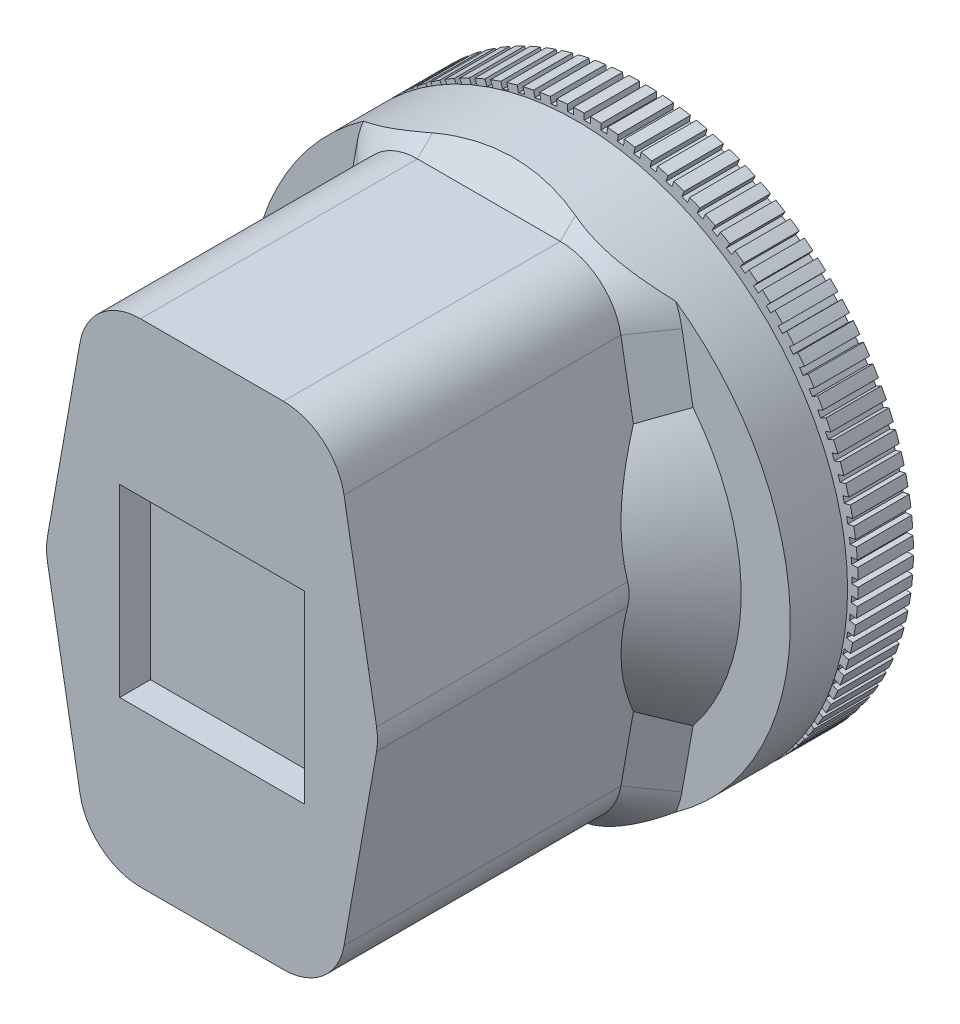
from build123d import *

# Parameters (mm, degrees)
SKETCH1_W                = 60
SKETCH1_H                = 80
BOSS_EXTRUDE1_DEPTH      = 30
SKETCH2_W                = 30
SKETCH2_H                = 30
CUT_EXTRUDE1_DEPTH       = 5
CHAMFER1_SIZE            = 56.712818196
CHAMFER1_SIZE_2          = 10
BOSS_EXTRUDE2_DEPTH      = 10
BOSS_EXTRUDE2_DEPTH_BACK = 20
SKETCH3_R                = 40
FILLET1_R                = 10
FILLET2_R                = 10
CHAMFER2_START           = -24.0000001
CHAMFER2_DEPTH           = 14.0000001
CHAMFER2_START_2         = -24.0000007
CHAMFER2_3_DEPTH         = 14.0000007
SKETCH4_R                = 44
BOSS_EXTRUDE3_DEPTH      = 20
CHAMFER3_SIZE            = 5
SKETCH5_W                = 7.255778377
SKETCH5_H                = 1.701163536
SKETCH6_W                = 1
SKETCH6_H                = 2
CUT_EXTRUDE2_DEPTH       = 10
CIRPATTERN1_COUNT        = 100
SKETCH7_R                = 37.5
SKETCH7_R_2              = 27.5
CUT_EXTRUDE3_DEPTH       = 10
SKETCH8_W                = 30
SKETCH8_H                = 30
CUT_EXTRUDE4_DEPTH       = 10


with BuildPart() as part:
    # Sketch1 → Boss-Extrude1 (new, symmetric)
    with BuildSketch(Plane.XY):
        with Locations((-156.698196892, 56.325115443)):
            Rectangle(SKETCH1_W, SKETCH1_H)
    extrude(amount=BOSS_EXTRUDE1_DEPTH, both=True)

    # Sketch2 → Cut-Extrude1 (cut, symmetric)
    with BuildSketch(Plane.XY.offset(30)):
        with Locations((-156.698196892, 56.325115443)):
            Rectangle(SKETCH2_W, SKETCH2_H)
    extrude(amount=CUT_EXTRUDE1_DEPTH, both=True, mode=Mode.SUBTRACT)

    # Chamfer1
    # the kernel refuses this chamfer: 56.712818196, 10 mm, written as the material it takes off along each edge
    with BuildSketch(Plane(origin=(-126.698196892, 16.325115443, 177.370458337), x_dir=(0, 1, 0), z_dir=(0, 0, -1)), Plane(origin=(-186.698196892, 16.325115443, -177.370458337), x_dir=(0, 1, 0), z_dir=(0, 0, 1))) as chamfer1_piece_1:
        Polygon((CHAMFER1_SIZE, 0), (0, -CHAMFER1_SIZE_2), (0, 0), align=None)
    extrude(amount=354.740916674, mode=Mode.SUBTRACT)
    with BuildSketch(Plane(origin=(-126.698196892, 96.325115443, 177.370458337), x_dir=(-1, 0, 0), z_dir=(0, 0, -1)), Plane(origin=(-186.698196892, 96.325115443, -177.370458337), x_dir=(1, 0, 0), z_dir=(0, 0, 1))) as chamfer1_piece_2:
        Polygon((CHAMFER1_SIZE_2, 0), (0, -CHAMFER1_SIZE), (0, 0), align=None)
    extrude(amount=354.740916674, mode=Mode.SUBTRACT)

    # Sketch3 → Boss-Extrude2 (add, two sides: drawn at the far end of the back side and taken through both)
    with BuildSketch(Plane(origin=(0, 0, -30), x_dir=(-1, 0, 0), z_dir=(0, 0, -1)).offset(-BOSS_EXTRUDE2_DEPTH_BACK)):
        with Locations((156.698196892, 56.325115443)):
            Circle(SKETCH3_R)
    extrude(amount=BOSS_EXTRUDE2_DEPTH + BOSS_EXTRUDE2_DEPTH_BACK)

    # Fillet1
    # the kernel refuses this fillet: 10 mm, written as the material it takes off along each edge
    with BuildSketch(Plane(origin=(-136.698196892, 16.325115443, 50.977490779), x_dir=(-1, 0, 0), z_dir=(0, 0, -1))) as fillet1_piece_1_section:
        with BuildLine():
            CenterArc((FILLET1_R * 0.839099631177, FILLET1_R), FILLET1_R, 190, 80)
            Line((-FILLET1_R * 0.145708121835, FILLET1_R * 0.826351822333), (0, 0))
            Line((0, 0), (FILLET1_R * 0.839099631177, 0))
        make_face()
    fillet1_piece_1 = extrude(amount=101.954981559, mode=Mode.PRIVATE)
    fillet1_piece_1 = fillet1_piece_1 - Plane(origin=(-156.698196892, 56.325115443, 50.977490779), x_dir=(-1, 0, 0), z_dir=(0, 0, -1)) * Cylinder(40, 238, mode=Mode.PRIVATE)
    fillet1_piece_1 = split(fillet1_piece_1, bisect_by=Plane(origin=(-136.698196892, 16.325115443, -10), z_dir=(0, 0, 1)), keep=Keep.TOP, mode=Mode.PRIVATE)
    add(fillet1_piece_1, mode=Mode.SUBTRACT)
    with BuildSketch(Plane(origin=(-136.698196892, 16.325115443, 50.977490779), x_dir=(-1, 0, 0), z_dir=(0, 0, -1))) as fillet1_piece_2_section:
        with BuildLine():
            CenterArc((FILLET1_R * 0.839099631177, FILLET1_R), FILLET1_R, 190, 80)
            Line((-FILLET1_R * 0.145708121835, FILLET1_R * 0.826351822333), (0, 0))
            Line((0, 0), (FILLET1_R * 0.839099631177, 0))
        make_face()
    fillet1_piece_2 = extrude(amount=101.954981559, mode=Mode.PRIVATE)
    fillet1_piece_2 = fillet1_piece_2 & Plane(origin=(-156.698196892, 56.325115443, 50.977490779), x_dir=(-1, 0, 0), z_dir=(0, 0, -1)) * Cylinder(40, 238, mode=Mode.PRIVATE)
    fillet1_piece_2 = split(fillet1_piece_2, bisect_by=Plane(origin=(-136.698196892, 16.325115443, -10), z_dir=(0, 0, 1)), keep=Keep.TOP, mode=Mode.PRIVATE)
    add(fillet1_piece_2, mode=Mode.SUBTRACT)
    with BuildSketch(Plane(origin=(-136.698196892, 16.325115443, 50.977490779), x_dir=(-1, 0, 0), z_dir=(0, 0, -1))) as fillet1_piece_3_section:
        with BuildLine():
            CenterArc((FILLET1_R * 0.839099631177, FILLET1_R), FILLET1_R, 190, 80)
            Line((-FILLET1_R * 0.145708121835, FILLET1_R * 0.826351822333), (0, 0))
            Line((0, 0), (FILLET1_R * 0.839099631177, 0))
        make_face()
    fillet1_piece_3 = extrude(amount=101.954981559, mode=Mode.PRIVATE)
    fillet1_piece_3 = fillet1_piece_3 - Plane(origin=(-156.698196892, 56.325115443, 50.977490779), x_dir=(-1, 0, 0), z_dir=(0, 0, -1)) * Cylinder(40, 238, mode=Mode.PRIVATE)
    fillet1_piece_3 = split(fillet1_piece_3, bisect_by=Plane(origin=(-136.698196892, 16.325115443, -10), z_dir=(0, 0, -1)), keep=Keep.TOP, mode=Mode.PRIVATE)
    add(fillet1_piece_3, mode=Mode.SUBTRACT)
    with BuildSketch(Plane(origin=(-176.698196892, 16.325115443, -50.977490779), x_dir=(-0.17364817766745544, 0.9848077530121156, 0), z_dir=(0, 0, 1))) as fillet1_piece_4_section:
        with BuildLine():
            CenterArc((FILLET1_R * 0.839099631177, -FILLET1_R), FILLET1_R, 90, 80)
            Line((-FILLET1_R * 0.145708121835, -FILLET1_R * 0.826351822333), (0, 0))
            Line((0, 0), (FILLET1_R * 0.839099631177, 0))
        make_face()
    fillet1_piece_4 = extrude(amount=101.954981559, mode=Mode.PRIVATE)
    fillet1_piece_4 = split(fillet1_piece_4, bisect_by=Plane(origin=(-176.698196892, 16.325115443, -10), z_dir=(0, 0, -1)), keep=Keep.TOP, mode=Mode.PRIVATE)
    fillet1_piece_4 = fillet1_piece_4 - Plane(origin=(-156.698196892, 56.325115443, -50.977490779), x_dir=(-1, 0, 0), z_dir=(0, 0, -1)) * Cylinder(40, 238, mode=Mode.PRIVATE)
    add(fillet1_piece_4, mode=Mode.SUBTRACT)
    with BuildSketch(Plane(origin=(-176.698196892, 16.325115443, -50.977490779), x_dir=(-0.17364817766745544, 0.9848077530121156, 0), z_dir=(0, 0, 1))) as fillet1_piece_5_section:
        with BuildLine():
            CenterArc((FILLET1_R * 0.839099631177, -FILLET1_R), FILLET1_R, 90, 80)
            Line((-FILLET1_R * 0.145708121835, -FILLET1_R * 0.826351822333), (0, 0))
            Line((0, 0), (FILLET1_R * 0.839099631177, 0))
        make_face()
    fillet1_piece_5 = extrude(amount=101.954981559, mode=Mode.PRIVATE)
    fillet1_piece_5 = split(fillet1_piece_5, bisect_by=Plane(origin=(-176.698196892, 16.325115443, -10), z_dir=(0, 0, 1)), keep=Keep.TOP, mode=Mode.PRIVATE)
    fillet1_piece_5 = fillet1_piece_5 & Plane(origin=(-156.698196892, 56.325115443, -50.977490779), x_dir=(-1, 0, 0), z_dir=(0, 0, -1)) * Cylinder(40, 238, mode=Mode.PRIVATE)
    add(fillet1_piece_5, mode=Mode.SUBTRACT)
    with BuildSketch(Plane(origin=(-176.698196892, 16.325115443, -50.977490779), x_dir=(-0.17364817766745544, 0.9848077530121156, 0), z_dir=(0, 0, 1))) as fillet1_piece_6_section:
        with BuildLine():
            CenterArc((FILLET1_R * 0.839099631177, -FILLET1_R), FILLET1_R, 90, 80)
            Line((-FILLET1_R * 0.145708121835, -FILLET1_R * 0.826351822333), (0, 0))
            Line((0, 0), (FILLET1_R * 0.839099631177, 0))
        make_face()
    fillet1_piece_6 = extrude(amount=101.954981559, mode=Mode.PRIVATE)
    fillet1_piece_6 = split(fillet1_piece_6, bisect_by=Plane(origin=(-176.698196892, 16.325115443, -10), z_dir=(0, 0, 1)), keep=Keep.TOP, mode=Mode.PRIVATE)
    fillet1_piece_6 = fillet1_piece_6 - Plane(origin=(-156.698196892, 56.325115443, -50.977490779), x_dir=(-1, 0, 0), z_dir=(0, 0, -1)) * Cylinder(40, 238, mode=Mode.PRIVATE)
    add(fillet1_piece_6, mode=Mode.SUBTRACT)
    with BuildSketch(Plane(origin=(-136.698196892, 96.325115443, 50.977490779), x_dir=(-1, 0, 0), z_dir=(0, 0, -1))) as fillet1_piece_7_section:
        with BuildLine():
            CenterArc((FILLET1_R * 0.839099631177, -FILLET1_R), FILLET1_R, 90, 80)
            Line((-FILLET1_R * 0.145708121835, -FILLET1_R * 0.826351822333), (0, 0))
            Line((0, 0), (FILLET1_R * 0.839099631177, 0))
        make_face()
    fillet1_piece_7 = extrude(amount=101.954981559, mode=Mode.PRIVATE)
    fillet1_piece_7 = split(fillet1_piece_7, bisect_by=Plane(origin=(-136.698196892, 96.325115443, -10), z_dir=(0, 0, 1)), keep=Keep.TOP, mode=Mode.PRIVATE)
    fillet1_piece_7 = fillet1_piece_7 - Plane(origin=(-156.698196892, 56.325115443, 50.977490779), x_dir=(-1, 0, 0), z_dir=(0, 0, -1)) * Cylinder(40, 238, mode=Mode.PRIVATE)
    add(fillet1_piece_7, mode=Mode.SUBTRACT)
    with BuildSketch(Plane(origin=(-136.698196892, 96.325115443, 50.977490779), x_dir=(-1, 0, 0), z_dir=(0, 0, -1))) as fillet1_piece_8_section:
        with BuildLine():
            CenterArc((FILLET1_R * 0.839099631177, -FILLET1_R), FILLET1_R, 90, 80)
            Line((-FILLET1_R * 0.145708121835, -FILLET1_R * 0.826351822333), (0, 0))
            Line((0, 0), (FILLET1_R * 0.839099631177, 0))
        make_face()
    fillet1_piece_8 = extrude(amount=101.954981559, mode=Mode.PRIVATE)
    fillet1_piece_8 = split(fillet1_piece_8, bisect_by=Plane(origin=(-136.698196892, 96.325115443, -10), z_dir=(0, 0, 1)), keep=Keep.TOP, mode=Mode.PRIVATE)
    fillet1_piece_8 = fillet1_piece_8 & Plane(origin=(-156.698196892, 56.325115443, 50.977490779), x_dir=(-1, 0, 0), z_dir=(0, 0, -1)) * Cylinder(40, 238, mode=Mode.PRIVATE)
    add(fillet1_piece_8, mode=Mode.SUBTRACT)
    with BuildSketch(Plane(origin=(-136.698196892, 96.325115443, 50.977490779), x_dir=(-1, 0, 0), z_dir=(0, 0, -1))) as fillet1_piece_9_section:
        with BuildLine():
            CenterArc((FILLET1_R * 0.839099631177, -FILLET1_R), FILLET1_R, 90, 80)
            Line((-FILLET1_R * 0.145708121835, -FILLET1_R * 0.826351822333), (0, 0))
            Line((0, 0), (FILLET1_R * 0.839099631177, 0))
        make_face()
    fillet1_piece_9 = extrude(amount=101.954981559, mode=Mode.PRIVATE)
    fillet1_piece_9 = split(fillet1_piece_9, bisect_by=Plane(origin=(-136.698196892, 96.325115443, -10), z_dir=(0, 0, -1)), keep=Keep.TOP, mode=Mode.PRIVATE)
    fillet1_piece_9 = fillet1_piece_9 - Plane(origin=(-156.698196892, 56.325115443, 50.977490779), x_dir=(-1, 0, 0), z_dir=(0, 0, -1)) * Cylinder(40, 238, mode=Mode.PRIVATE)
    add(fillet1_piece_9, mode=Mode.SUBTRACT)
    with BuildSketch(Plane(origin=(-176.698196892, 96.325115443, -50.977490779), x_dir=(1, 0, 0), z_dir=(0, 0, 1))) as fillet1_piece_10_section:
        with BuildLine():
            CenterArc((FILLET1_R * 0.839099631177, -FILLET1_R), FILLET1_R, 90, 80)
            Line((-FILLET1_R * 0.145708121835, -FILLET1_R * 0.826351822333), (0, 0))
            Line((0, 0), (FILLET1_R * 0.839099631177, 0))
        make_face()
    fillet1_piece_10 = extrude(amount=101.954981559, mode=Mode.PRIVATE)
    fillet1_piece_10 = fillet1_piece_10 - Plane(origin=(-156.698196892, 56.325115443, -50.977490779), x_dir=(-1, 0, 0), z_dir=(0, 0, -1)) * Cylinder(40, 238, mode=Mode.PRIVATE)
    fillet1_piece_10 = split(fillet1_piece_10, bisect_by=Plane(origin=(-176.698196892, 96.325115443, -10), z_dir=(0, 0, -1)), keep=Keep.TOP, mode=Mode.PRIVATE)
    add(fillet1_piece_10, mode=Mode.SUBTRACT)
    with BuildSketch(Plane(origin=(-176.698196892, 96.325115443, -50.977490779), x_dir=(1, 0, 0), z_dir=(0, 0, 1))) as fillet1_piece_11_section:
        with BuildLine():
            CenterArc((FILLET1_R * 0.839099631177, -FILLET1_R), FILLET1_R, 90, 80)
            Line((-FILLET1_R * 0.145708121835, -FILLET1_R * 0.826351822333), (0, 0))
            Line((0, 0), (FILLET1_R * 0.839099631177, 0))
        make_face()
    fillet1_piece_11 = extrude(amount=101.954981559, mode=Mode.PRIVATE)
    fillet1_piece_11 = fillet1_piece_11 - Plane(origin=(-156.698196892, 56.325115443, -50.977490779), x_dir=(-1, 0, 0), z_dir=(0, 0, -1)) * Cylinder(40, 238, mode=Mode.PRIVATE)
    fillet1_piece_11 = split(fillet1_piece_11, bisect_by=Plane(origin=(-176.698196892, 96.325115443, -10), z_dir=(0, 0, 1)), keep=Keep.TOP, mode=Mode.PRIVATE)
    add(fillet1_piece_11, mode=Mode.SUBTRACT)
    with BuildSketch(Plane(origin=(-176.698196892, 96.325115443, -50.977490779), x_dir=(1, 0, 0), z_dir=(0, 0, 1))) as fillet1_piece_12_section:
        with BuildLine():
            CenterArc((FILLET1_R * 0.839099631177, -FILLET1_R), FILLET1_R, 90, 80)
            Line((-FILLET1_R * 0.145708121835, -FILLET1_R * 0.826351822333), (0, 0))
            Line((0, 0), (FILLET1_R * 0.839099631177, 0))
        make_face()
    fillet1_piece_12 = extrude(amount=101.954981559, mode=Mode.PRIVATE)
    fillet1_piece_12 = fillet1_piece_12 & Plane(origin=(-156.698196892, 56.325115443, -50.977490779), x_dir=(-1, 0, 0), z_dir=(0, 0, -1)) * Cylinder(40, 238, mode=Mode.PRIVATE)
    fillet1_piece_12 = split(fillet1_piece_12, bisect_by=Plane(origin=(-176.698196892, 96.325115443, -10), z_dir=(0, 0, 1)), keep=Keep.TOP, mode=Mode.PRIVATE)
    add(fillet1_piece_12, mode=Mode.SUBTRACT)

    # Fillet2
    fillet2_edges = [part.edges().sort_by_distance(p)[0] for p in [
        (-183.75127612, 56.325115443, 10),
        (-129.645117664, 56.325115443, 10),
    ]]
    fillet(fillet2_edges, radius=FILLET2_R)

    # Chamfer2: read off the stored shape, not the designer's step
    # Chamfer2 outline → Chamfer2 (cut)
    with BuildSketch(Plane.XY.offset(CHAMFER2_START)):
        with BuildLine():
            ThreePointArc((-136.037863961, 22.073828706), (-116.698196892, 56.325115443), (-136.03786396, 90.57640218))
            ThreePointArc((-136.03786396, 90.57640218), (-156.698196892, 96.325115443), (-177.358529824, 90.57640218))
            ThreePointArc((-177.358529824, 90.57640218), (-196.698196892, 56.325115443), (-177.358529823, 22.073828706))
            ThreePointArc((-177.358529823, 22.073828706), (-156.698196892, 16.325115443), (-136.037863961, 22.073828706))
        make_face()
    extrude(amount=CHAMFER2_DEPTH, mode=Mode.SUBTRACT)

    # Chamfer2 2 outline → Chamfer2 2 (revolve)
    with BuildSketch(Plane(origin=(-156.698196892, 56.325115443, 0), x_dir=(1, 0, 0), z_dir=(0, -1, 0))):
        Polygon((40, -24), (26.641334205, -10.641334205), (0, -10.641334205), (0, -24), align=None)
    revolve(axis=Axis((-156.698196892, 56.325115443, 0), (0, 0, 1)))

    # Chamfer2 3 outline → Chamfer2 3 (add)
    with BuildSketch(Plane.XY.offset(CHAMFER2_START_2)):
        with BuildLine():
            Line((-129.951306252, 58.06159722), (-135.241115674, 88.06159722))
            ThreePointArc((-135.241115674, 88.06159722), (-135.556200227, 89.345387766), (-136.03786396, 90.57640218))
            ThreePointArc((-136.03786396, 90.57640218), (-145.975591553, 94.861147085), (-156.698196892, 96.325115443))
            ThreePointArc((-156.698196892, 96.325115443), (-167.420802231, 94.861147085), (-177.358529824, 90.57640218))
            ThreePointArc((-177.358529824, 90.57640218), (-177.840193557, 89.345387766), (-178.15527811, 88.06159722))
            Line((-178.15527811, 88.06159722), (-183.445087531, 58.06159722))
            ThreePointArc((-183.445087531, 58.06159722), (-183.597010001, 56.325115444), (-183.445087531, 54.588633667))
            Line((-183.445087531, 54.588633667), (-178.15527811, 24.588633667))
            ThreePointArc((-178.15527811, 24.588633667), (-177.840193557, 23.304843121), (-177.358529824, 22.073828706))
            ThreePointArc((-177.358529824, 22.073828706), (-167.420802231, 17.789083801), (-156.698196892, 16.325115443))
            ThreePointArc((-156.698196892, 16.325115443), (-145.975591553, 17.789083801), (-136.037863961, 22.073828706))
            ThreePointArc((-136.037863961, 22.073828706), (-135.556200227, 23.304843121), (-135.241115674, 24.588633667))
            Line((-135.241115674, 24.588633667), (-129.951306252, 54.588633667))
            ThreePointArc((-129.951306252, 54.588633667), (-129.799383782, 56.325115444), (-129.951306252, 58.06159722))
        make_face()
    extrude(amount=CHAMFER2_3_DEPTH)

    # Sketch4 → Boss-Extrude3 (add)
    with BuildSketch(Plane(origin=(0, 0, -40), x_dir=(-1, 0, 0), z_dir=(0, 0, -1))):
        with Locations((156.698196892, 56.325115443)):
            Circle(SKETCH4_R)
    extrude(amount=-BOSS_EXTRUDE3_DEPTH)

    # Chamfer3
    # the kernel refuses this chamfer: 5 mm, written as the material it adds along each edge
    with BuildSketch(Plane(origin=(-132.432320123, 40.518104806, -20), x_dir=(0, 0, 1), z_dir=(-0.17364817769068303, -0.9848077530080199, 0)), Plane(origin=(-178.15527811, 24.588633667, -20), x_dir=(0, 0, 1), z_dir=(-0.17364817765884538, 0.9848077530136338, 0))) as chamfer3_piece_1:
        Polygon((CHAMFER3_SIZE, 0), (0, -CHAMFER3_SIZE), (0, 0), align=None)
    extrude(amount=16.175208908)
    with BuildSketch(Plane(origin=(-145.089193204, 26.325115443, -20), x_dir=(0, -1, 0), z_dir=(-1, 0, 0))) as chamfer3_piece_2_section:
        Polygon((10, CHAMFER3_SIZE), (10 + CHAMFER3_SIZE, 0), (10, 0), align=None)
    chamfer3_piece_2 = revolve(axis=Axis((-145.089193204, 26.325115443, -20), (0, 0, 1)), revolution_arc=64.841191691, mode=Mode.PRIVATE)
    chamfer3_piece_2 = chamfer3_piece_2 & Plane(origin=(-156.698196892, 56.325115443, -20), x_dir=(-1, 0, 0), z_dir=(0, 0, -1)) * Cylinder(44, 61, mode=Mode.PRIVATE)
    add(chamfer3_piece_2)
    with BuildSketch(Plane(origin=(-168.30720058, 26.325115443, -20), x_dir=(0, -1, 0), z_dir=(1, 0, 0))) as chamfer3_piece_3_section:
        Polygon((10, -CHAMFER3_SIZE), (10 + CHAMFER3_SIZE, 0), (10, 0), align=None)
    chamfer3_piece_3 = revolve(axis=Axis((-168.30720058, 26.325115443, -20), (0, 0, -1)), revolution_arc=64.841191691, mode=Mode.PRIVATE)
    chamfer3_piece_3 = chamfer3_piece_3 & Plane(origin=(-156.698196892, 56.325115443, -20), x_dir=(-1, 0, 0), z_dir=(0, 0, -1)) * Cylinder(44, 60, mode=Mode.PRIVATE)
    add(chamfer3_piece_3)
    with BuildSketch(Plane(origin=(-156.698196892, 16.325115443, -20), x_dir=(0, 0, 1), z_dir=(-1, 0, 0))) as chamfer3_piece_4_section:
        Polygon((CHAMFER3_SIZE, 0), (0, -CHAMFER3_SIZE), (0, 0), align=None)
    chamfer3_piece_4 = extrude(amount=11.609003688, mode=Mode.PRIVATE)
    chamfer3_piece_4 = chamfer3_piece_4 & Plane(origin=(-156.698196892, 56.325115443, -20), x_dir=(-1, 0, 0), z_dir=(0, 0, -1)) * Cylinder(44, 44, mode=Mode.PRIVATE)
    add(chamfer3_piece_4)
    with BuildSketch(Plane(origin=(-180.96407366, 72.13212608, -20), x_dir=(0, 0, 1), z_dir=(0.17364817765884544, 0.9848077530136338, 0)), Plane(origin=(-135.241115674, 88.06159722, -20), x_dir=(0, 0, 1), z_dir=(0.17364817769068305, -0.9848077530080198, 0))) as chamfer3_piece_5:
        Polygon((CHAMFER3_SIZE, 0), (0, -CHAMFER3_SIZE), (0, 0), align=None)
    extrude(amount=16.175208909)
    with BuildSketch(Plane(origin=(-168.30720058, 86.325115443, -20), x_dir=(-0.9051329243834763, 0.42512867369423146, 0), z_dir=(-0.42512867369423146, -0.9051329243834763, 0))) as chamfer3_piece_6_section:
        Polygon((10, -CHAMFER3_SIZE), (10 + CHAMFER3_SIZE, 0), (10, 0), align=None)
    chamfer3_piece_6 = revolve(axis=Axis((-168.30720058, 86.325115443, -20), (0, 0, -1)), revolution_arc=64.841191691, mode=Mode.PRIVATE)
    chamfer3_piece_6 = chamfer3_piece_6 & Plane(origin=(-156.698196892, 56.325115443, -20), x_dir=(-1, 0, 0), z_dir=(0, 0, -1)) * Cylinder(44, 60, mode=Mode.PRIVATE)
    add(chamfer3_piece_6)
    with BuildSketch(Plane(origin=(-145.089193204, 86.325115443, -20), x_dir=(0.9051329243834769, 0.42512867369423035, 0), z_dir=(0.42512867369423035, -0.9051329243834769, 0))) as chamfer3_piece_7_section:
        Polygon((10 + CHAMFER3_SIZE, 0), (10, CHAMFER3_SIZE), (10, 0), align=None)
    chamfer3_piece_7 = revolve(axis=Axis((-145.089193204, 86.325115443, -20), (0, 0, 1)), revolution_arc=64.841191691, mode=Mode.PRIVATE)
    chamfer3_piece_7 = chamfer3_piece_7 & Plane(origin=(-156.698196892, 56.325115443, -20), x_dir=(-1, 0, 0), z_dir=(0, 0, -1)) * Cylinder(44, 60, mode=Mode.PRIVATE)
    add(chamfer3_piece_7)
    with BuildSketch(Plane(origin=(-168.30720058, 96.325115443, -20), x_dir=(0, 0, 1), z_dir=(1, 0, 0))) as chamfer3_piece_8_section:
        Polygon((CHAMFER3_SIZE, 0), (0, -CHAMFER3_SIZE), (0, 0), align=None)
    chamfer3_piece_8 = extrude(amount=11.609003688, mode=Mode.PRIVATE)
    chamfer3_piece_8 = chamfer3_piece_8 & Plane(origin=(-156.698196892, 56.325115443, -20), x_dir=(-1, 0, 0), z_dir=(0, 0, -1)) * Cylinder(44, 44, mode=Mode.PRIVATE)
    add(chamfer3_piece_8)
    with BuildSketch(Plane(origin=(-156.698196892, 96.325115443, -20), x_dir=(0, 0, 1), z_dir=(1, 0, 0))) as chamfer3_piece_9_section:
        Polygon((CHAMFER3_SIZE, 0), (0, -CHAMFER3_SIZE), (0, 0), align=None)
    chamfer3_piece_9 = extrude(amount=11.609003688, mode=Mode.PRIVATE)
    chamfer3_piece_9 = chamfer3_piece_9 & Plane(origin=(-156.698196892, 56.325115443, -20), x_dir=(-1, 0, 0), z_dir=(0, 0, -1)) * Cylinder(44, 44, mode=Mode.PRIVATE)
    add(chamfer3_piece_9)
    with BuildSketch(Plane(origin=(-145.089193185, 86.32511545, -20), x_dir=(0.90513292430982, 0.42512867385105135, 0), z_dir=(-0.42512867385105135, 0.90513292430982, 0))) as chamfer3_piece_10_section:
        Polygon((9.99999998, -CHAMFER3_SIZE), (9.99999998 + CHAMFER3_SIZE, 0), (9.99999998, 0), align=None)
    chamfer3_piece_10 = revolve(axis=Axis((-145.089193185, 86.32511545, -20), (0, 0, -1)), revolution_arc=15.158808337, mode=Mode.PRIVATE)
    chamfer3_piece_10 = chamfer3_piece_10 & Plane(origin=(-156.698196892, 56.325115443, -20), x_dir=(-1, 0, 0), z_dir=(0, 0, -1)) * Cylinder(44, 60, mode=Mode.PRIVATE)
    add(chamfer3_piece_10)
    with BuildSketch(Plane(origin=(-168.307200599, 86.32511545, -20), x_dir=(-0.9848077530674926, 0.17364817735339633, 0), z_dir=(-0.17364817735339633, -0.9848077530674926, 0))) as chamfer3_piece_11_section:
        Polygon((9.99999998, -CHAMFER3_SIZE), (9.99999998 + CHAMFER3_SIZE, 0), (9.99999998, 0), align=None)
    chamfer3_piece_11 = revolve(axis=Axis((-168.307200599, 86.32511545, -20), (0, 0, -1)), revolution_arc=15.158808337, mode=Mode.PRIVATE)
    chamfer3_piece_11 = chamfer3_piece_11 & Plane(origin=(-156.698196892, 56.325115443, -20), x_dir=(-1, 0, 0), z_dir=(0, 0, -1)) * Cylinder(44, 60, mode=Mode.PRIVATE)
    add(chamfer3_piece_11)
    with BuildSketch(Plane(origin=(-145.089193204, 16.325115443, -20), x_dir=(0, 0, 1), z_dir=(-1, 0, 0))) as chamfer3_piece_12_section:
        Polygon((CHAMFER3_SIZE, 0), (0, -CHAMFER3_SIZE), (0, 0), align=None)
    chamfer3_piece_12 = extrude(amount=11.609003688, mode=Mode.PRIVATE)
    chamfer3_piece_12 = chamfer3_piece_12 & Plane(origin=(-156.698196892, 56.325115443, -20), x_dir=(-1, 0, 0), z_dir=(0, 0, -1)) * Cylinder(44, 44, mode=Mode.PRIVATE)
    add(chamfer3_piece_12)
    with BuildSketch(Plane(origin=(-168.307200575, 26.325115443, -20), x_dir=(-0.905132924475684, -0.42512867349791345, 0), z_dir=(0.42512867349791345, -0.905132924475684, 0))) as chamfer3_piece_13_section:
        Polygon((10.000000005, -CHAMFER3_SIZE), (10.000000005 + CHAMFER3_SIZE, 0), (10.000000005, 0), align=None)
    chamfer3_piece_13 = revolve(axis=Axis((-168.307200575, 26.325115443, -20), (0, 0, -1)), revolution_arc=15.158808309, mode=Mode.PRIVATE)
    chamfer3_piece_13 = chamfer3_piece_13 & Plane(origin=(-156.698196892, 56.325115443, -20), x_dir=(-1, 0, 0), z_dir=(0, 0, -1)) * Cylinder(44, 61, mode=Mode.PRIVATE)
    add(chamfer3_piece_13)
    with BuildSketch(Plane(origin=(-145.089193158, 26.325115431, -20), x_dir=(0.9848077530990935, -0.17364817717417896, 0), z_dir=(0.17364817717417896, 0.9848077530990935, 0))) as chamfer3_piece_14_section:
        Polygon((9.999999953, -CHAMFER3_SIZE), (9.999999953 + CHAMFER3_SIZE, 0), (9.999999953, 0), align=None)
    chamfer3_piece_14 = revolve(axis=Axis((-145.089193158, 26.325115431, -20), (0, 0, -1)), revolution_arc=15.158808386, mode=Mode.PRIVATE)
    chamfer3_piece_14 = chamfer3_piece_14 & Plane(origin=(-156.698196892, 56.325115443, -20), x_dir=(-1, 0, 0), z_dir=(0, 0, -1)) * Cylinder(44, 60, mode=Mode.PRIVATE)
    add(chamfer3_piece_14)

    # Sketch5 → Cut-Revolve2 (revolve, cut)
    with BuildSketch(Plane(origin=(0, 56.325115443, 0), x_dir=(1, 0, 0), z_dir=(0, 1, 0))):
        with Locations((-200.698196892, 30.149418232)):
            Rectangle(SKETCH5_W, SKETCH5_H)
    revolve(axis=Axis((-156.698196892, 56.325115443, 30), (0, 0, -1)), mode=Mode.SUBTRACT)

    # Sketch6 → Cut-Extrude2 (cut)
    with BuildSketch(Plane(origin=(0, 0, -40), x_dir=(-1, 0, 0), z_dir=(0, 0, -1))):
        with Locations((156.698196892, 100.325115443)):
            Rectangle(SKETCH6_W, SKETCH6_H)
    cut_extrude2 = extrude(amount=-CUT_EXTRUDE2_DEPTH, mode=Mode.SUBTRACT)

    # CirPattern1: Cut-Extrude2 ×100 about axis
    cirpattern1_axis = Axis((-156.698196892, 56.325115443, 0), (0, 0, 1))
    for i in range(1, CIRPATTERN1_COUNT):
        add(cut_extrude2.rotate(cirpattern1_axis, i * 360 / CIRPATTERN1_COUNT), mode=Mode.SUBTRACT)

    # Sketch7 → Cut-Extrude3 (cut)
    with BuildSketch(Plane(origin=(0, 0, -40), x_dir=(-1, 0, 0), z_dir=(0, 0, -1))):
        with Locations((156.698196892, 56.325115443)):
            Circle(SKETCH7_R)
        with Locations((156.698196892, 56.325115443)):
            Circle(SKETCH7_R_2, mode=Mode.SUBTRACT)
    extrude(amount=-CUT_EXTRUDE3_DEPTH, mode=Mode.SUBTRACT)

    # Sketch8 → Cut-Extrude4 (cut)
    with BuildSketch(Plane(origin=(0, 0, -40), x_dir=(-1, 0, 0), z_dir=(0, 0, -1))):
        with Locations((156.698196892, 56.325115443)):
            Rectangle(SKETCH8_W, SKETCH8_H)
    extrude(amount=-CUT_EXTRUDE4_DEPTH, mode=Mode.SUBTRACT)


solid = part.part
